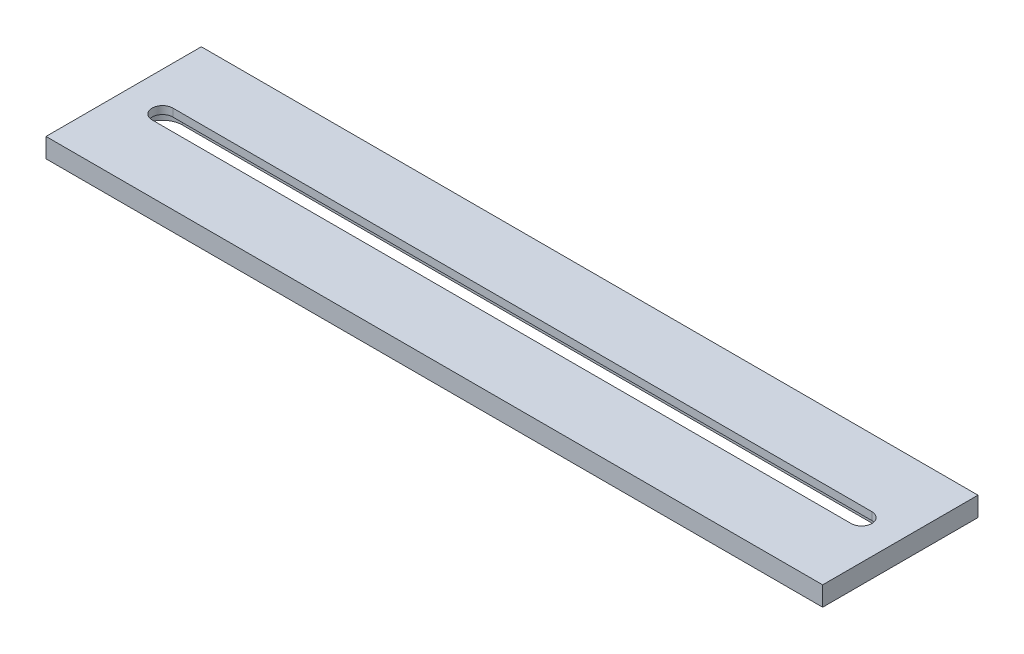
from build123d import *

# Parameters (mm, degrees)
SKETCH1_W           = 254
SKETCH1_H           = 50.8
BOSS_EXTRUDE1_DEPTH = 6.35
CUT_EXTRUDE1_DEPTH  = 130.67066939
CUT_EXTRUDE2_DEPTH  = 3.81


with BuildPart() as part:
    # Sketch1 → Boss-Extrude1 (new body)
    with BuildSketch(Plane(origin=(0, 0, 0), x_dir=(1, 0, 0), z_dir=(0, 1, 0))):
        Rectangle(SKETCH1_W, SKETCH1_H)
    extrude(amount=BOSS_EXTRUDE1_DEPTH)

    # Sketch2 → Cut-Extrude1 (cut, through all)
    with BuildSketch(Plane(origin=(0, 6.35, 0), x_dir=(1, 0, 0), z_dir=(0, 1, 0))):
        with BuildLine():
            Line((-114.3, 3.3782), (114.3, 3.3782))
            ThreePointArc((114.3, 3.3782), (117.6782, 0), (114.3, -3.3782))
            Line((114.3, -3.3782), (-114.3, -3.3782))
            ThreePointArc((-114.3, -3.3782), (-117.6782, 0), (-114.3, 3.3782))
        make_face()
    extrude(amount=-CUT_EXTRUDE1_DEPTH, mode=Mode.SUBTRACT)

    # Sketch3 → Cut-Extrude2 (cut)
    with BuildSketch(Plane.XZ):
        with BuildLine():
            Line((-114.3, 6.477), (114.3, 6.477))
            ThreePointArc((114.3, 6.477), (120.777, 0), (114.3, -6.477))
            Line((114.3, -6.477), (-114.3, -6.477))
            ThreePointArc((-114.3, -6.477), (-120.777, 0), (-114.3, 6.477))
        make_face()
    extrude(amount=-CUT_EXTRUDE2_DEPTH, mode=Mode.SUBTRACT)


solid = part.part
